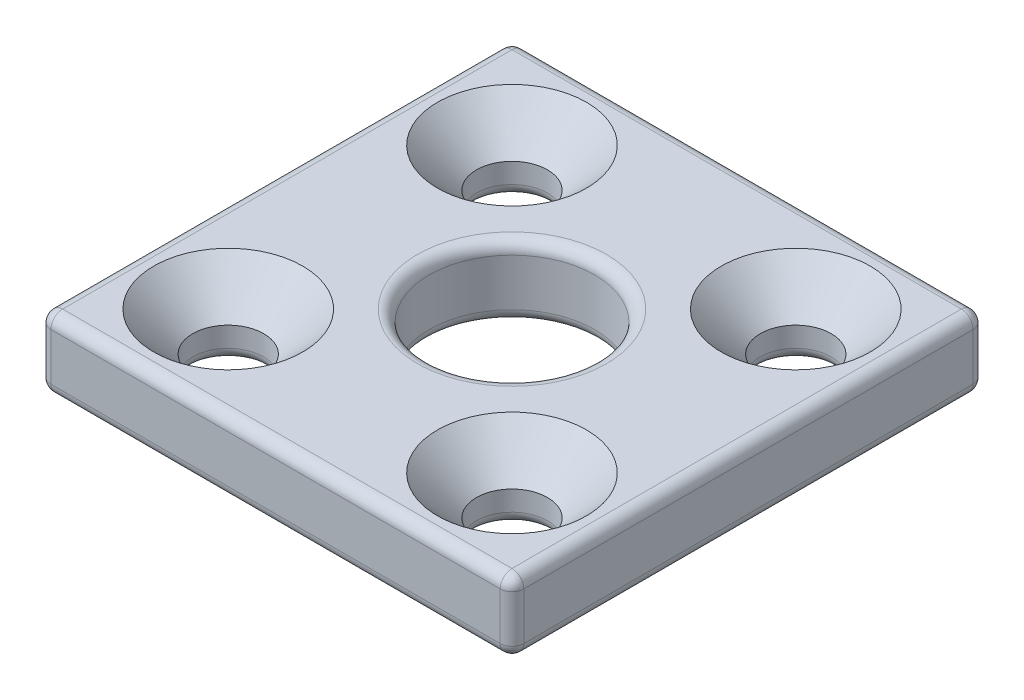
from build123d import *

# Parameters (mm, degrees)
SKETCH1_W           = 20
SKETCH1_H           = 20
SKETCH1_R           = 1.5
SKETCH1_R_2         = 3.5
BOSS_EXTRUDE1_DEPTH = 3
CHAMFER1_SIZE       = 1.65
FILLET1_R           = 0.5


with BuildPart() as part:
    # Sketch1 → Boss-Extrude1 (new body)
    with BuildSketch(Plane(origin=(0, 0, 0), x_dir=(1, 0, 0), z_dir=(0, 1, 0))):
        with Locations((10, 10)):
            Rectangle(SKETCH1_W, SKETCH1_H)
        with Locations((16, 16)):
            Circle(SKETCH1_R, mode=Mode.SUBTRACT)
        with Locations((4, 16)):
            Circle(SKETCH1_R, mode=Mode.SUBTRACT)
        with Locations((16, 4)):
            Circle(SKETCH1_R, mode=Mode.SUBTRACT)
        with Locations((4, 4)):
            Circle(SKETCH1_R, mode=Mode.SUBTRACT)
        with Locations((10, 10)):
            Circle(SKETCH1_R_2, mode=Mode.SUBTRACT)
    extrude(amount=BOSS_EXTRUDE1_DEPTH)

    # Chamfer1
    chamfer1_edges = [part.edges().sort_by_distance(p)[0] for p in [
        (14.5, 3, -4),
        (2.5, 3, -4),
        (2.5, 3, -16),
        (14.5, 3, -16),
    ]]
    chamfer(chamfer1_edges, length=CHAMFER1_SIZE)

    # Fillet1
    fillet1_edges = [part.edges().sort_by_distance(p)[0] for p in [
        (14.5, 0, -4),
        (14.5, 0, -16),
        (2.5, 0, -16),
        (2.5, 0, -4),
        (6.5, 0, -10),
        (6.5, 3, -10),
        (20, 3, -10),
        (20, 0, -10),
        (20, 1.5, -20),
        (10, 3, -20),
        (10, 0, -20),
        (0, 1.5, -20),
        (0, 3, -10),
        (0, 0, -10),
        (0, 1.5, 0),
        (10, 3, 0),
        (20, 1.5, 0),
        (10, 0, 0),
    ]]
    fillet(fillet1_edges, radius=FILLET1_R)


solid = part.part
